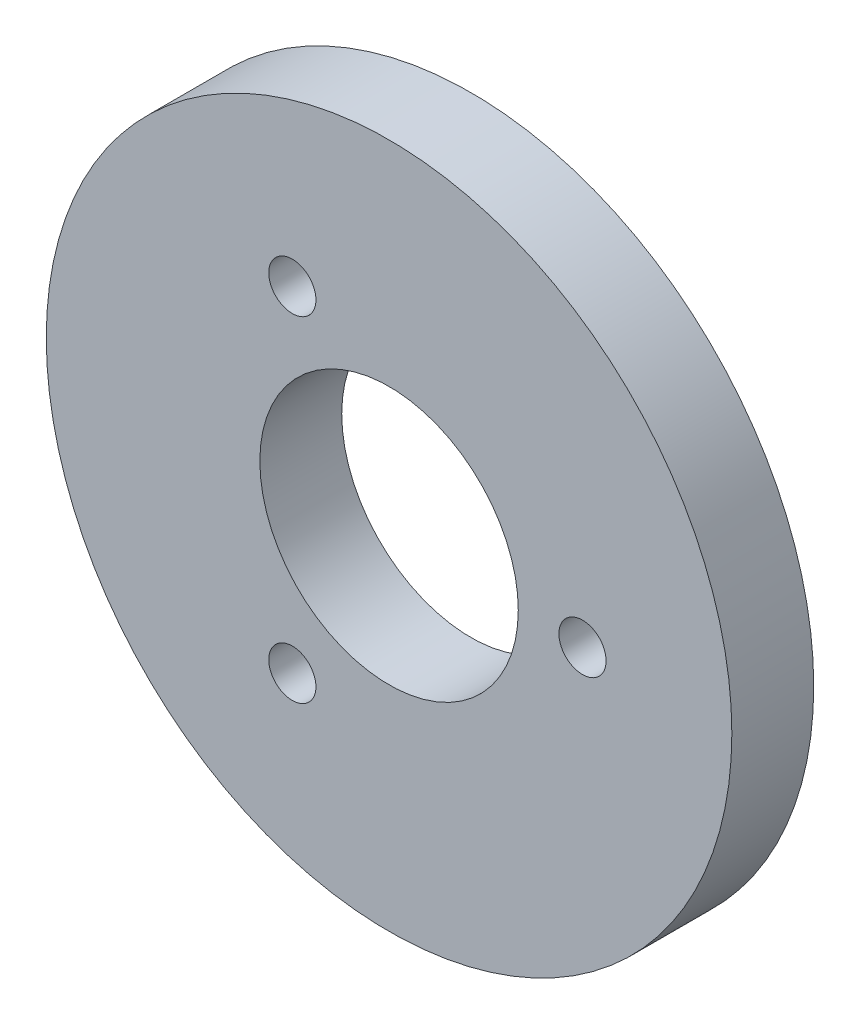
from build123d import *

# Parameters (mm, degrees)
SKETCH1_R           = 26.5811
SKETCH1_R_2         = 10.0203
SKETCH1_R_3         = 1.8288
BOSS_EXTRUDE1_DEPTH = 6.35


with BuildPart() as part:
    # Sketch1 → Boss-Extrude1 (new body)
    with BuildSketch(Plane.XY):
        with Locations((123.739144453, 1.282311101)):
            Circle(SKETCH1_R)
        with Locations((123.739144453, 1.282311101)):
            Circle(SKETCH1_R_2, mode=Mode.SUBTRACT)
        with Locations((138.739144453, 1.282311101)):
            Circle(SKETCH1_R_3, mode=Mode.SUBTRACT)
        with Locations((116.239144453, -11.708069956)):
            Circle(SKETCH1_R_3, mode=Mode.SUBTRACT)
        with Locations((116.239144453, 14.272692158)):
            Circle(SKETCH1_R_3, mode=Mode.SUBTRACT)
    extrude(amount=BOSS_EXTRUDE1_DEPTH)


solid = part.part
